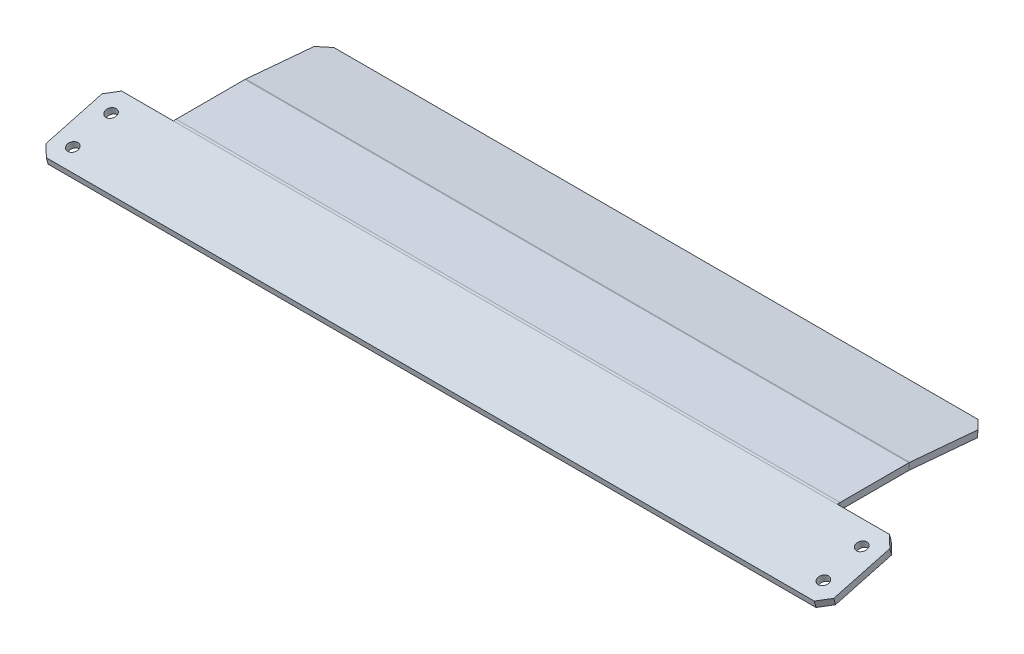
from build123d import *

# Parameters (mm, degrees)
SKETCH1_W                        = 425.45
SKETCH1_H                        = 44.45
BASE_FLANGE1_DEPTH               = 4.2672
EDGE_FLANGE1_STRIP_CUT_DEPTH     = 425.45
EDGE_FLANGE1_DEPTH               = 425.45
EDGE_FLANGE1_START               = 4.2672
EDGE_FLANGE1_PROFILE_W           = 504.825
EDGE_FLANGE1_PROFILE_H           = 49.905487105
EDGE_FLANGE1_FLAT_DEPTH          = 4.2672
EDGE_FLANGE2_STRIP_CUT_DEPTH     = 425.45
EDGE_FLANGE2_DEPTH               = 425.45
CHAMFER1_SIZE                    = 6.35
F_17_64_0_26563_DIAMETER_HOLE1_D = 6.747002


# Sheet-metal steps are written as plain solids
with BuildPart() as part:
    # Sketch1 → Base-Flange1 (new body)
    with BuildSketch(Plane(origin=(0, 0, 0), x_dir=(1, 0, 0), z_dir=(0, 1, 0))):
        Rectangle(SKETCH1_W, SKETCH1_H)
    extrude(amount=-BASE_FLANGE1_DEPTH)

    # Edge-Flange1 strip (across the edge) → Edge-Flange1 strip cut (cut)
    with BuildSketch(Plane(origin=(212.725, -4.2672, 22.225), x_dir=(0, -0.96592582628907, -0.2588190451025146), z_dir=(-1, 0, 0))):
        Polygon((-9.522131081, 19.049882248), (-4.052559965, -1.362835054), (0.069238721, -0.258402425), (-5.400332395, 20.154314877), align=None)
    extrude(amount=EDGE_FLANGE1_STRIP_CUT_DEPTH, mode=Mode.SUBTRACT)

    # Edge-Flange1 bend section (across the edge) → Edge-Flange1 (add)
    with BuildSketch(Plane(origin=(212.725, -4.2672, 22.225), x_dir=(0, -0.96592582628907, -0.2588190451025146), z_dir=(-1, 0, 0))):
        with BuildLine():
            Line((-4.2672, 0.267517875), (0, 0.267517875))
            ThreePointArc((0, 0.267517875), (0.017384042, 0.002288653), (0.069238721, -0.258402425))
            Line((0.069238721, -0.258402425), (-4.052559965, -1.362835054))
            ThreePointArc((-4.052559965, -1.362835054), (-4.213309471, -0.554692715), (-4.2672, 0.267517875))
        make_face()
    extrude(amount=EDGE_FLANGE1_DEPTH)

    # Edge-Flange1 profile (on flange) → Edge-Flange1 flat (add)
    with BuildSketch(Plane(origin=(0, -4.2672, 22.225), x_dir=(-1, 0, 0), z_dir=(0, 0.96592582628907, 0.2588190451025146)).offset(EDGE_FLANGE1_START)):
        with Locations((0, 25.220261428)):
            Rectangle(EDGE_FLANGE1_PROFILE_W, EDGE_FLANGE1_PROFILE_H)
    extrude(amount=-EDGE_FLANGE1_FLAT_DEPTH)

    # Edge-Flange2 strip (across the edge) → Edge-Flange2 strip cut (cut)
    with BuildSketch(Plane(origin=(-212.725, -4.2672, -22.225), x_dir=(0, -0.9961946980917461, 0.08715574274765156), z_dir=(1, 0, 0))):
        Polygon((-6.085074523, 20.592090897), (-4.243229642, -0.460292419), (0.007732373, -0.088381433), (-1.834112507, 20.964001883), align=None)
    extrude(amount=EDGE_FLANGE2_STRIP_CUT_DEPTH, mode=Mode.SUBTRACT)

    # Edge-Flange2 section (across the edge) → Edge-Flange2 (add)
    with BuildSketch(Plane(origin=(-212.725, -4.2672, -22.225), x_dir=(0, -0.9961946980917461, 0.08715574274765156), z_dir=(1, 0, 0))):
        with BuildLine():
            Line((-4.2672, 0.088719036), (-4.2672, 50.38333524))
            Line((-4.2672, 50.38333524), (0, 50.38333524))
            Line((0, 50.38333524), (0, 0.088719036))
            ThreePointArc((0, 0.088719036), (0.001934014, 8.4441e-05), (0.007732373, -0.088381433))
            Line((0.007732373, -0.088381433), (-4.243229642, -0.460292419))
            ThreePointArc((-4.243229642, -0.460292419), (-4.261204557, -0.186048209), (-4.2672, 0.088719036))
        make_face()
    extrude(amount=EDGE_FLANGE2_DEPTH)

    # Chamfer1
    chamfer1_edges = [part.edges().sort_by_distance(p)[0] for p in [
        (-252.4125, -2.275539378, 23.035618739),
        (252.4125, -2.275539378, 23.035618739),
        (252.4125, -15.192029896, 71.240617608),
        (-252.4125, -15.192029896, 71.240617608),
        (-212.725, -6.532915997, -72.602566931),
        (212.725, -6.532915997, -72.602566931),
    ]]
    chamfer(chamfer1_edges, length=CHAMFER1_SIZE)

    # 17/64 (0.26563) Diameter Hole1 (through all)
    with Locations(Plane(origin=(0, 5.696696884, 1.52642533), x_dir=(1, 0, 0), z_dir=(0, 0.96592582628907, 0.2588190451025147))):
        with Locations((-240.50625, -35.539651994), (-240.50625, -60.939651994), (240.50625, -60.939651994), (240.50625, -35.539651994)):
            Hole(F_17_64_0_26563_DIAMETER_HOLE1_D / 2)


solid = part.part
